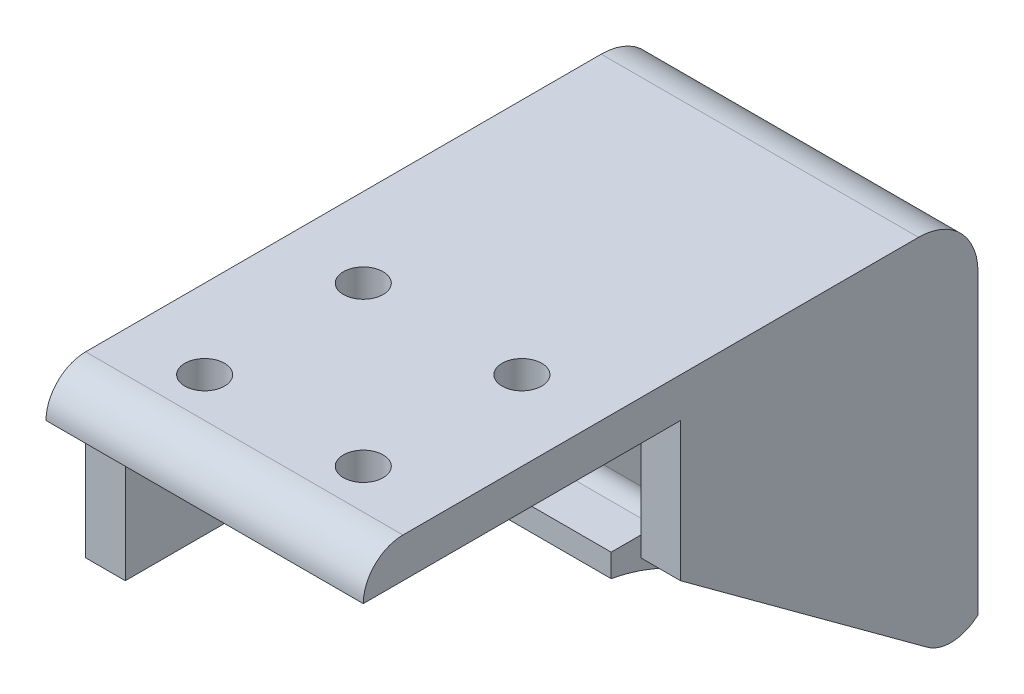
from build123d import *

# Parameters (mm, degrees)
SKETCH1_W           = 2
SKETCH1_H           = 14
BOSS_EXTRUDE1_DEPTH = 7
SKETCH2_W           = 16
SKETCH2_H           = 16
BOSS_EXTRUDE2_DEPTH = 2
BOSS_EXTRUDE3_DEPTH = 2
BOSS_EXTRUDE4_DEPTH = 2
SKETCH6_W           = 12
SKETCH6_H           = 15
BOSS_EXTRUDE5_DEPTH = 2
SKETCH7_W           = 12
SKETCH7_H           = 16
BOSS_EXTRUDE6_DEPTH = 2
SKETCH8_W           = 12
SKETCH8_H           = 17
BOSS_EXTRUDE7_DEPTH = 2
SKETCH9_W           = 12
SKETCH9_H           = 3.5
BOSS_EXTRUDE9_DEPTH = 1
FILLET1_R           = 3
FILLET2_R           = 10
FILLET3_R           = 2
CUT_EXTRUDE4_REACH  = 32.199
SKETCH14_R          = 1
FILLET4_R           = 2
CUT_EXTRUDE5_DEPTH  = 26.159491251
FILLET5_R           = 2


# Some blends are built 0.0001 mm under size
with BuildPart() as part:
    # Sketch1 → Boss-Extrude1 (new body)
    with BuildSketch(Plane(origin=(0, 0, 0), x_dir=(1, 0, 0), z_dir=(0, 1, 0))):
        with Locations((1, -7)):
            Rectangle(SKETCH1_W, SKETCH1_H)
    extrude(amount=BOSS_EXTRUDE1_DEPTH)

    # Sketch2 → Boss-Extrude2 (add)
    with BuildSketch(Plane(origin=(0, 7, 0), x_dir=(1, 0, 0), z_dir=(0, 1, 0))):
        with Locations((8, -8)):
            Rectangle(SKETCH2_W, SKETCH2_H)
    extrude(amount=BOSS_EXTRUDE2_DEPTH)

    # Sketch4 → Boss-Extrude3 (add)
    with BuildSketch(Plane(origin=(16, 0, 0), x_dir=(0, 0, -1), z_dir=(1, 0, 0))):
        Polygon((0, 0), (15, -11), (15, 9), (0, 9), align=None)
    extrude(amount=-BOSS_EXTRUDE3_DEPTH)

    # Sketch5 → Boss-Extrude4 (add)
    with BuildSketch(Plane.ZY):
        Polygon((0, 9), (-15, 9), (-15, -11), (0, 0), align=None)
    extrude(amount=-BOSS_EXTRUDE4_DEPTH)

    # Sketch6 → Boss-Extrude5 (add)
    with BuildSketch(Plane(origin=(0, 9, 0), x_dir=(1, 0, 0), z_dir=(0, 1, 0))):
        with Locations((8, 7.5)):
            Rectangle(SKETCH6_W, SKETCH6_H)
    extrude(amount=-BOSS_EXTRUDE5_DEPTH)

    # Sketch7 → Boss-Extrude6 (add)
    with BuildSketch(Plane(origin=(0, 0, -15), x_dir=(-1, 0, 0), z_dir=(0, 0, -1))):
        with Locations((-8, -1)):
            Rectangle(SKETCH7_W, SKETCH7_H)
    extrude(amount=-BOSS_EXTRUDE6_DEPTH)

    # Sketch8 → Boss-Extrude7 (add)
    with BuildSketch(Plane(origin=(0, 0, 0), x_dir=(1, 0, 0), z_dir=(0, -0.8064049958557057, 0.5913636636275174))):
        with Locations((8, -8.5)):
            Rectangle(SKETCH8_W, SKETCH8_H)
    extrude(amount=-BOSS_EXTRUDE7_DEPTH)

    # Sketch9 → Boss-Extrude9 (add)
    with BuildSketch(Plane.XZ):
        with Locations((8, -0.25)):
            Rectangle(SKETCH9_W, SKETCH9_H)
    extrude(amount=-BOSS_EXTRUDE9_DEPTH)

    # Fillet1
    fillet1_edges = [part.edges().sort_by_distance(p)[0] for p in [
        (8, 9, -15),
    ]]
    fillet(fillet1_edges, radius=FILLET1_R)

    # Fillet2
    # the kernel refuses this fillet: 10 mm, written as the material it adds along each edge
    with BuildSketch(Plane(origin=(0, 0, 0), x_dir=(0, -0.5913636636275174, -0.8064049958557056), z_dir=(1, 0, 0))) as fillet2_piece_1_section:
        with BuildLine():
            CenterArc((FILLET2_R * 0.327370476158, -FILLET2_R), FILLET2_R, 90, 36.253837737)
            Line((-FILLET2_R * 0.263993187469, -FILLET2_R * 0.193595004144), (0, 0))
            Line((0, 0), (FILLET2_R * 0.327370476158, 0))
        make_face()
    fillet2_piece_1 = extrude(amount=14, mode=Mode.PRIVATE)
    fillet2_piece_1 = split(fillet2_piece_1, bisect_by=Plane(origin=(1, -0.664008542, 1.5), z_dir=(0, 0, -1)), keep=Keep.TOP, mode=Mode.PRIVATE)
    add(fillet2_piece_1)
    with BuildSketch(Plane(origin=(0, 0, 0), x_dir=(0, -0.5913636636275174, -0.8064049958557056), z_dir=(1, 0, 0))) as fillet2_piece_2_section:
        with BuildLine():
            CenterArc((FILLET2_R * 0.327370476158, -FILLET2_R), FILLET2_R, 90, 36.253837737)
            Line((-FILLET2_R * 0.263993187469, -FILLET2_R * 0.193595004144), (0, 0))
            Line((0, 0), (FILLET2_R * 0.327370476158, 0))
        make_face()
    fillet2_piece_2 = extrude(amount=22.184261904, mode=Mode.PRIVATE)
    fillet2_piece_2 = split(fillet2_piece_2, bisect_by=Plane(origin=(2, -0.047502187, 1.942720069), z_dir=(-1, 0, 0)), keep=Keep.TOP, mode=Mode.PRIVATE)
    add(fillet2_piece_2)

    # Fillet3
    fillet3_edges = [part.edges().sort_by_distance(p)[0] for p in [
        (8, 9, 16),
    ]]
    fillet(fillet3_edges, radius=FILLET3_R - 0.0001)  # a hair under: the kernel refuses the full size

    # Sketch14 → Cut-Extrude4 (cut, up to next)
    with BuildSketch(Plane(origin=(0, 9, 0), x_dir=(1, 0, 0), z_dir=(0, 1, 0)), mode=Mode.PRIVATE) as cut_extrude4_sk1:
        with Locations(Location((4, -12, 0), (0, 0, 270))):
            Circle(SKETCH14_R)
    cut_extrude4_tool1 = extrude(cut_extrude4_sk1.sketch, amount=-CUT_EXTRUDE4_REACH, mode=Mode.PRIVATE) & part.part
    # Sketch14 → Cut-Extrude4 (cut, up to next)
    with BuildSketch(Plane(origin=(0, 9, 0), x_dir=(1, 0, 0), z_dir=(0, 1, 0)), mode=Mode.PRIVATE) as cut_extrude4_sk2:
        with Locations(Location((4, -4, 0), (0, 0, 270))):
            Circle(SKETCH14_R)
    cut_extrude4_tool2 = extrude(cut_extrude4_sk2.sketch, amount=-CUT_EXTRUDE4_REACH, mode=Mode.PRIVATE) & part.part
    # Sketch14 → Cut-Extrude4 (cut, up to next)
    with BuildSketch(Plane(origin=(0, 9, 0), x_dir=(1, 0, 0), z_dir=(0, 1, 0)), mode=Mode.PRIVATE) as cut_extrude4_sk3:
        with Locations(Location((12, -12, 0), (0, 0, 270))):
            Circle(SKETCH14_R)
    cut_extrude4_tool3 = extrude(cut_extrude4_sk3.sketch, amount=-CUT_EXTRUDE4_REACH, mode=Mode.PRIVATE) & part.part
    # Sketch14 → Cut-Extrude4 (cut, up to next)
    with BuildSketch(Plane(origin=(0, 9, 0), x_dir=(1, 0, 0), z_dir=(0, 1, 0)), mode=Mode.PRIVATE) as cut_extrude4_sk4:
        with Locations(Location((12, -4, 0), (0, 0, 270))):
            Circle(SKETCH14_R)
    cut_extrude4_tool4 = extrude(cut_extrude4_sk4.sketch, amount=-CUT_EXTRUDE4_REACH, mode=Mode.PRIVATE) & part.part
    add(cut_extrude4_tool1.solids().sort_by_distance((4, 9, 12))[0], mode=Mode.SUBTRACT)
    add(cut_extrude4_tool2.solids().sort_by_distance((4, 9, 4))[0], mode=Mode.SUBTRACT)
    add(cut_extrude4_tool3.solids().sort_by_distance((12, 9, 12))[0], mode=Mode.SUBTRACT)
    add(cut_extrude4_tool4.solids().sort_by_distance((12, 9, 4))[0], mode=Mode.SUBTRACT)

    # Fillet4
    # the kernel refuses this fillet: 2 mm, written as the material it takes off along each edge
    with BuildSketch(Plane(origin=(14, 1.612809992, -1.182727327), x_dir=(0, -0.5913636636275179, -0.806404995855705), z_dir=(-1, 0, 0))) as fillet4_piece_1:
        with BuildLine():
            CenterArc((1.569146973, 2), FILLET4_R, 218.318751839, 51.681248161)
            Line((0, 0.759928317), (-0.031382939, 0.735126884))
            ThreePointArc((-0.031382939, 0.735126884), (-0.04, 0.379964159), (-0.04, 0))
            Line((-0.04, 0), (0, -0.04))
            Line((0, -0.04), (1.569146973, -0.04))
            Line((1.569146973, -0.04), (1.569146973, 0))
        make_face()
    extrude(amount=12, mode=Mode.SUBTRACT)

    # Sketch15 → Cut-Extrude5 (cut, through all)
    with BuildSketch(Plane(origin=(16, 0, 0), x_dir=(0, 0, -1), z_dir=(1, 0, 0))):
        Polygon((13.636363636, -10), (15, -11), (15, -9), align=None)
    extrude(amount=-CUT_EXTRUDE5_DEPTH, mode=Mode.SUBTRACT)

    # Fillet5
    # the kernel refuses this fillet: 2 mm, written as the material it takes off along each edge
    with BuildSketch(Plane(origin=(19.666666667, -10, -13.636363636), x_dir=(0, 0.5913636636275166, 0.806404995855706), z_dir=(-1, 0, 0))) as fillet5_piece_1:
        with BuildLine():
            CenterArc((FILLET5_R * 0.733333333333, FILLET5_R), FILLET5_R, 197.492324525, 72.507675475)
            Line((-FILLET5_R * 0.2204238921, FILLET5_R * 0.699421965318), (0, 0))
            Line((0, 0), (FILLET5_R * 0.733333333333, 0))
        make_face()
    extrude(amount=23.333333333, mode=Mode.SUBTRACT)


solid = part.part
